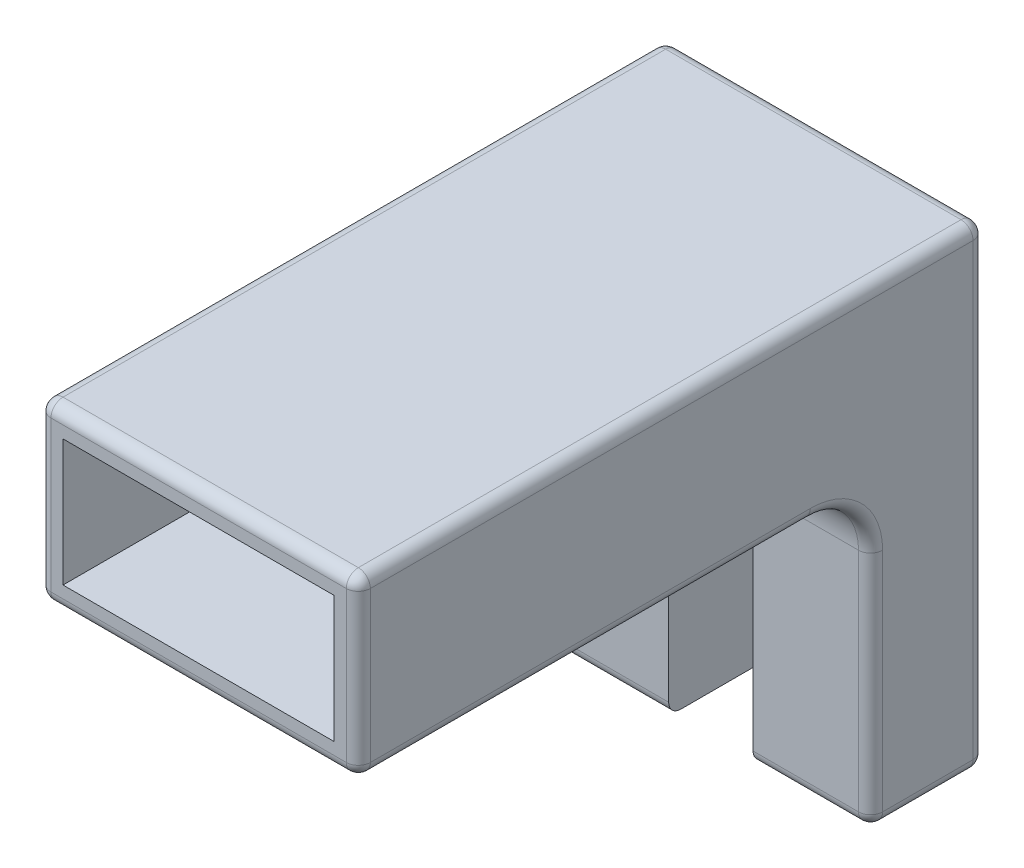
from build123d import *

# Parameters (mm, degrees)
SKETCH_2_W          = 26.5
SKETCH_2_H          = 14.5
EXTRUDE_1_DEPTH     = 52
SKETCH_6_W          = 22.5
SKETCH_6_H          = 10.5
CUT_EXTRUDE_1_DEPTH = 49
SKETCH_7_W          = 26.5
SKETCH_7_H          = 9.5
EXTRUDE_2_DEPTH     = 24.8
FILLET_1_R          = 5
FILLET_2_R          = 1
FILLET_4_R          = 1
FILLET_5_R          = 1
FILLET_6_R          = 1
SKETCH_8_W          = 7
SKETCH_8_H          = 9.5
CUT_EXTRUDE_2_DEPTH = 20


with BuildPart() as part:
    # ｽｹｯﾁ2 → ﾎﾞｽ - 押し出し1 (new body)
    with BuildSketch(Plane.XY):
        with Locations((13.25, 7.25)):
            Rectangle(SKETCH_2_W, SKETCH_2_H)
    extrude(amount=EXTRUDE_1_DEPTH)

    # ｽｹｯﾁ6 → ｶｯﾄ - 押し出し1 (cut)
    with BuildSketch(Plane.XY.offset(52)):
        with Locations((13.25, 7.25)):
            Rectangle(SKETCH_6_W, SKETCH_6_H)
    extrude(amount=-CUT_EXTRUDE_1_DEPTH, mode=Mode.SUBTRACT)

    # ｽｹｯﾁ7 → ﾎﾞｽ - 押し出し2 (add)
    with BuildSketch(Plane.XZ):
        with Locations((13.25, 4.75)):
            Rectangle(SKETCH_7_W, SKETCH_7_H)
    extrude(amount=EXTRUDE_2_DEPTH)

    # ﾌｨﾚｯﾄ1
    fillet_1_edges = [part.edges().sort_by_distance(p)[0] for p in [
        (13.25, 0, 9.5),
    ]]
    fillet(fillet_1_edges, radius=FILLET_1_R)

    # ﾌｨﾚｯﾄ2
    fillet_2_edges = [part.edges().sort_by_distance(p)[0] for p in [
        (26.5, 14.5, 26),
    ]]
    fillet(fillet_2_edges, radius=FILLET_2_R)

    # ﾌｨﾚｯﾄ4
    fillet_4_edges = [part.edges().sort_by_distance(p)[0] for p in [
        (26.5, -14.9, 9.5),
        (26.5, -24.8, 4.75),
        (26.5, -1.464466094, 10.964466094),
        (12.75, 14.5, 0),
        (26.207106781, 14.207106781, 0),
        (26.5, -5.65, 0),
        (26.5, 0, 33.25),
    ]]
    fillet(fillet_4_edges, radius=FILLET_4_R)

    # ﾌｨﾚｯﾄ5
    # the kernel refuses this fillet: 1 mm, written as the material it takes off along each edge
    with BuildSketch(Plane(origin=(25.5, -23.8, 8.5), x_dir=(0, -1, 0), z_dir=(0, 0, 1))) as fillet_5_piece_1_section:
        Polygon((0, 0), (FILLET_5_R, 0), (FILLET_5_R, FILLET_5_R), (0, FILLET_5_R), align=None)
    fillet_5_piece_1 = extrude(amount=FILLET_5_R, mode=Mode.PRIVATE)
    fillet_5_piece_1 = fillet_5_piece_1 - Plane(origin=(25.5, -23.8, 8.5), x_dir=(-0.7071067811865475, 0.7071067811865475, 0), z_dir=(0, 0, 1)) * Sphere(FILLET_5_R, mode=Mode.PRIVATE)
    add(fillet_5_piece_1, mode=Mode.SUBTRACT)
    with BuildSketch(Plane(origin=(25.5, -23.8, 1), x_dir=(0, -1, 0), z_dir=(0, 0, -1))) as fillet_5_piece_2_section:
        Polygon((0, 0), (FILLET_5_R, 0), (FILLET_5_R, -FILLET_5_R), (0, -FILLET_5_R), align=None)
    fillet_5_piece_2 = extrude(amount=FILLET_5_R, mode=Mode.PRIVATE)
    fillet_5_piece_2 = fillet_5_piece_2 - Plane(origin=(25.5, -23.8, 1), x_dir=(-0.7071067811865475, 0.7071067811865475, 0), z_dir=(0, 0, -1)) * Sphere(FILLET_5_R, mode=Mode.PRIVATE)
    add(fillet_5_piece_2, mode=Mode.SUBTRACT)
    with BuildSketch(Plane(origin=(1, -23.8, 8.5), x_dir=(-1, 0, 0), z_dir=(0, -1, 0))) as fillet_5_piece_3_section:
        Polygon((0, 0), (FILLET_5_R, 0), (FILLET_5_R, -FILLET_5_R), (0, -FILLET_5_R), align=None)
    fillet_5_piece_3 = extrude(amount=FILLET_5_R, mode=Mode.PRIVATE)
    fillet_5_piece_3 = fillet_5_piece_3 - Plane(origin=(1, -23.8, 8.5), x_dir=(0.7071067811865475, 0, -0.7071067811865475), z_dir=(0, -1, 0)) * Sphere(FILLET_5_R, mode=Mode.PRIVATE)
    add(fillet_5_piece_3, mode=Mode.SUBTRACT)
    with BuildSketch(Plane(origin=(1, -23.8, 1), x_dir=(-1, 0, 0), z_dir=(0, 0, -1))) as fillet_5_piece_4_section:
        Polygon((0, 0), (FILLET_5_R, 0), (FILLET_5_R, -FILLET_5_R), (0, -FILLET_5_R), align=None)
    fillet_5_piece_4 = extrude(amount=FILLET_5_R, mode=Mode.PRIVATE)
    fillet_5_piece_4 = fillet_5_piece_4 - Plane(origin=(1, -23.8, 1), x_dir=(0.7071067811865475, 0.7071067811865475, 0), z_dir=(0, 0, -1)) * Sphere(FILLET_5_R, mode=Mode.PRIVATE)
    add(fillet_5_piece_4, mode=Mode.SUBTRACT)
    with BuildSketch(Plane(origin=(0, -5, 9.5), x_dir=(0, 0, -1), z_dir=(0, -1, 0))) as fillet_5_piece_5:
        with BuildLine():
            CenterArc((FILLET_5_R, FILLET_5_R), FILLET_5_R, 180, 90)
            Line((0, FILLET_5_R), (0, 0))
            Line((0, 0), (FILLET_5_R, 0))
        make_face()
    extrude(amount=18.8, mode=Mode.SUBTRACT)
    with BuildSketch(Plane(origin=(0, -24.8, 8.5), x_dir=(0, 1, 0), z_dir=(0, 0, -1))) as fillet_5_piece_6:
        with BuildLine():
            CenterArc((FILLET_5_R, FILLET_5_R), FILLET_5_R, 180, 90)
            Line((0, FILLET_5_R), (0, 0))
            Line((0, 0), (FILLET_5_R, 0))
        make_face()
    extrude(amount=7.5, mode=Mode.SUBTRACT)
    with BuildSketch(Plane(origin=(1, -24.8, 0), x_dir=(0, 1, 0), z_dir=(1, 0, 0)), Plane(origin=(25.5, -24.8, 9.5), x_dir=(0, 1, 0), z_dir=(-1, 0, 0))) as fillet_5_piece_7:
        with BuildLine():
            CenterArc((FILLET_5_R, FILLET_5_R), FILLET_5_R, 180, 90)
            Line((0, FILLET_5_R), (0, 0))
            Line((0, 0), (FILLET_5_R, 0))
        make_face()
    extrude(amount=24.5, mode=Mode.SUBTRACT)
    with BuildSketch(Plane(origin=(0, -5, 14.5), x_dir=(0, 1, 0), z_dir=(0, 0, 1))) as fillet_5_piece_8:
        with BuildLine():
            CenterArc((5 + FILLET_5_R, -FILLET_5_R), FILLET_5_R, 90, 90)
            Line((5, -FILLET_5_R), (5, 0))
            Line((5, 0), (5 + FILLET_5_R, 0))
        make_face()
    revolve(axis=Axis((0, -5, 14.5), (-1, 0, 0)), revolution_arc=90, mode=Mode.SUBTRACT)
    with BuildSketch(Plane(origin=(0, 13.5, 0), x_dir=(0, 0, 1), z_dir=(0, -1, 0))) as fillet_5_piece_9:
        with BuildLine():
            CenterArc((FILLET_5_R, -FILLET_5_R), FILLET_5_R, 90, 90)
            Line((0, -FILLET_5_R), (0, 0))
            Line((0, 0), (FILLET_5_R, 0))
        make_face()
    extrude(amount=37.3, mode=Mode.SUBTRACT)
    with BuildSketch(Plane(origin=(0, 13.5, 1), x_dir=(0, 0, -1), z_dir=(0, -1, 0))) as fillet_5_piece_10:
        with BuildLine():
            CenterArc((1 - FILLET_5_R, FILLET_5_R), FILLET_5_R, 270, 90)
            Line((1, FILLET_5_R), (1, 0))
            Line((1, 0), (1 - FILLET_5_R, 0))
        make_face()
    revolve(axis=Axis((0, 13.5, 1), (1, 0, 0)), revolution_arc=90, mode=Mode.SUBTRACT)
    with BuildSketch(Plane(origin=(0, 14.5, 1), x_dir=(1, 0, 0), z_dir=(0, 0, 1))) as fillet_5_piece_11:
        with BuildLine():
            CenterArc((FILLET_5_R, -FILLET_5_R), FILLET_5_R, 90, 90)
            Line((0, -FILLET_5_R), (0, 0))
            Line((0, 0), (FILLET_5_R, 0))
        make_face()
    extrude(amount=53.5, mode=Mode.SUBTRACT)
    with BuildSketch(Plane(origin=(0, 0, 14.5), x_dir=(1, 0, 0), z_dir=(0, 0, 1))) as fillet_5_piece_12:
        with BuildLine():
            CenterArc((FILLET_5_R, FILLET_5_R), FILLET_5_R, 180, 90)
            Line((0, FILLET_5_R), (0, 0))
            Line((0, 0), (FILLET_5_R, 0))
        make_face()
    extrude(amount=40, mode=Mode.SUBTRACT)

    # ﾌｨﾚｯﾄ6
    fillet_6_edges = [part.edges().sort_by_distance(p)[0] for p in [
        (13.25, 14.5, 52),
        (26.207106781, 14.207106781, 52),
        (26.5, 7.25, 52),
        (26.207106781, 0.292893219, 52),
        (0, 7.25, 52),
        (13.25, 0, 52),
        (0.292893219, 0.292893219, 52),
        (0.292893219, 14.207106781, 52),
    ]]
    fillet(fillet_6_edges, radius=FILLET_6_R)

    # ｽｹｯﾁ8 → ｶｯﾄ - 押し出し2 (cut)
    with BuildSketch(Plane.XZ.offset(24.8)):
        with Locations((13.25, 4.75)):
            Rectangle(SKETCH_8_W, SKETCH_8_H)
    extrude(amount=-CUT_EXTRUDE_2_DEPTH, mode=Mode.SUBTRACT)


solid = part.part
